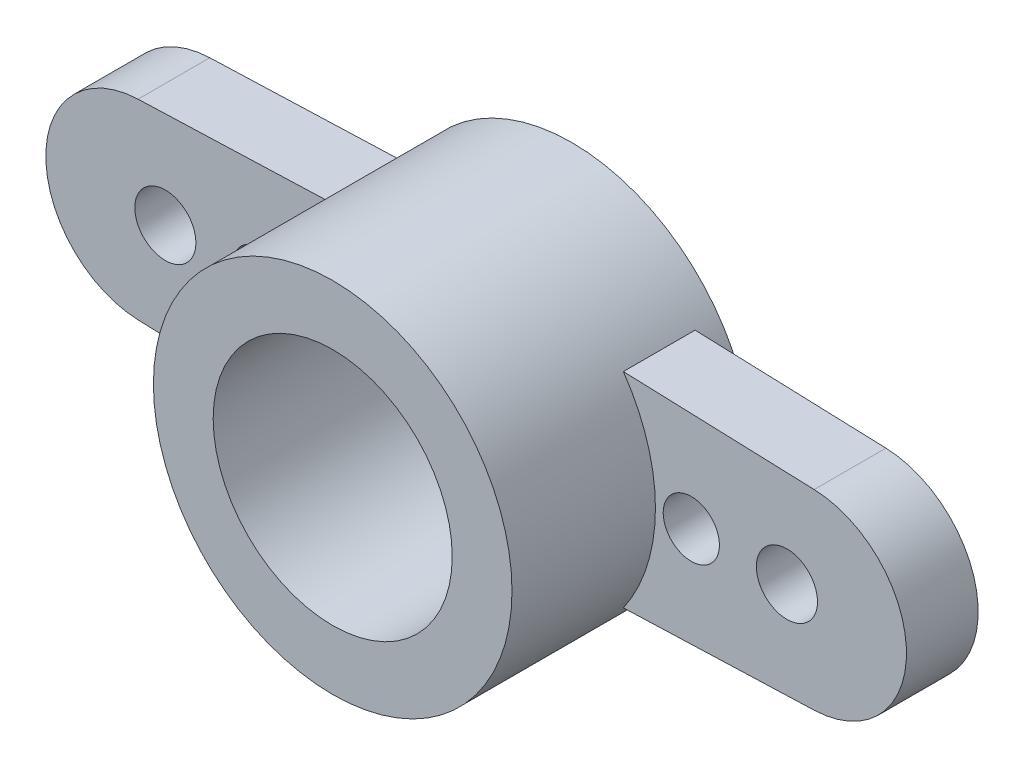
from build123d import *
from build123d.topology import SkipClean

# Parameters (mm, degrees)
EXTRUDE_3_DEPTH              = 1.5
EXTRUDE_3_2_DEPTH            = 1.5
SKETCH_2_R                   = 3.75
SKETCH_2_R_2                 = 2.5
EXTRUDE_5_DEPTH              = 3
EXTRUDE_START                = 2
SKETCH_3_R                   = 3.75
SKETCH_3_R_2                 = 2.5
EXTRUDE_6_DEPTH              = 2
ESQUISSE1_R                  = 0.587851578
ESQUISSE1_R_2                = 0.638983792
ENL_V_MAT_EXTRU_1_DEPTH      = 10
R_P_TITION_CIRCULAIRE1_COUNT = 2


with BuildPart() as part:
    # Эскиз1 → Бобышка-Вытянуть3 (new body)
    with BuildSketch(Plane.XY):
        with BuildLine():
            ThreePointArc((-3.079299832, -2.140189839), (-3.57839869, -1.121411082), (-3.75, 0))
            ThreePointArc((-3.75, 0), (-3.57839869, 1.121411082), (-3.079299832, 2.140189839))
            Line((-3.079299832, 2.140189839), (-7.07082784, 1.998745461))
            ThreePointArc((-7.07082784, 1.998745461), (-9, 0), (-7.07082784, -1.998745461))
            Line((-7.07082784, -1.998745461), (-3.079299832, -2.140189839))
        make_face()
    extrude_3 = extrude(amount=EXTRUDE_3_DEPTH)



with BuildPart() as body_2:
    # Эскиз1 → Extrude 3 2 (new body)
    with BuildSketch(Plane.XY):
        with BuildLine():
            Line((3.079299832, 2.140189839), (1.172975936, 2.207742615))
            ThreePointArc((1.172975936, 2.207742615), (2.5, 0), (1.172975936, -2.207742615))
            Line((1.172975936, -2.207742615), (3.079299832, -2.140189839))
            ThreePointArc((3.079299832, -2.140189839), (3.75, 0), (3.079299832, 2.140189839))
        make_face()
    extrude_3_2 = extrude(amount=EXTRUDE_3_2_DEPTH)


with BuildPart() as body_3:
    # Эскиз2 → Бобышка-Вытянуть5 (new body)
    with BuildSketch(Plane.XY.offset(1.5)):
        Circle(SKETCH_2_R)
        Circle(SKETCH_2_R_2, mode=Mode.SUBTRACT)
    extrude(amount=EXTRUDE_5_DEPTH)


with BuildPart() as part_1:
    with SkipClean():  # the faces are left unmerged after this step: merging them gives an invalid solid
        add(part.part)

        add(body_2.part)  # Бобышка-Вытянуть6 merges body 2

        add(body_3.part)  # Бобышка-Вытянуть6 merges body 3
        # Эскиз3 → Бобышка-Вытянуть6 (add)
        with BuildSketch(Plane(origin=(0, 0, 1.5), x_dir=(-1, 0, 0), z_dir=(0, 0, -1)).offset(EXTRUDE_START)):
            Circle(SKETCH_3_R)
            Circle(SKETCH_3_R_2, mode=Mode.SUBTRACT)
        extrude(amount=-EXTRUDE_6_DEPTH)

    # Esquisse1 → Enlèv. mat.-Extru.1 (cut)
    with SkipClean():  # the faces are left unmerged after this step: merging them gives an invalid solid
        with BuildSketch(Plane.XY.offset(1.5)):
            with Locations((-4.5, 0)):
                Circle(ESQUISSE1_R)
            with Locations((-6.5, 0)):
                Circle(ESQUISSE1_R_2)
        enl_v_mat_extru_1 = extrude(amount=-ENL_V_MAT_EXTRU_1_DEPTH, mode=Mode.SUBTRACT)

    # Répétition circulaire1: Бобышка-Вытянуть3, Extrude 3 2, Enlèv. mat.-Extru.1 ×2 about axis
    with SkipClean():  # the faces are left unmerged after this step: merging them gives an invalid solid
        r_p_tition_circulaire1_axis = Axis((0, 0, 4.5), (0, 0, 1))
        add([extrude_3.rotate(r_p_tition_circulaire1_axis, i * 360 / R_P_TITION_CIRCULAIRE1_COUNT) for i in range(1, R_P_TITION_CIRCULAIRE1_COUNT)])
        add([extrude_3_2.rotate(r_p_tition_circulaire1_axis, i * 360 / R_P_TITION_CIRCULAIRE1_COUNT) for i in range(1, R_P_TITION_CIRCULAIRE1_COUNT)])
        add([enl_v_mat_extru_1.rotate(r_p_tition_circulaire1_axis, i * 360 / R_P_TITION_CIRCULAIRE1_COUNT) for i in range(1, R_P_TITION_CIRCULAIRE1_COUNT)], mode=Mode.SUBTRACT)
    add(part_1.part.scale(1), mode=Mode.REPLACE)  # the faces are merged on a copy


solid = part_1.part
